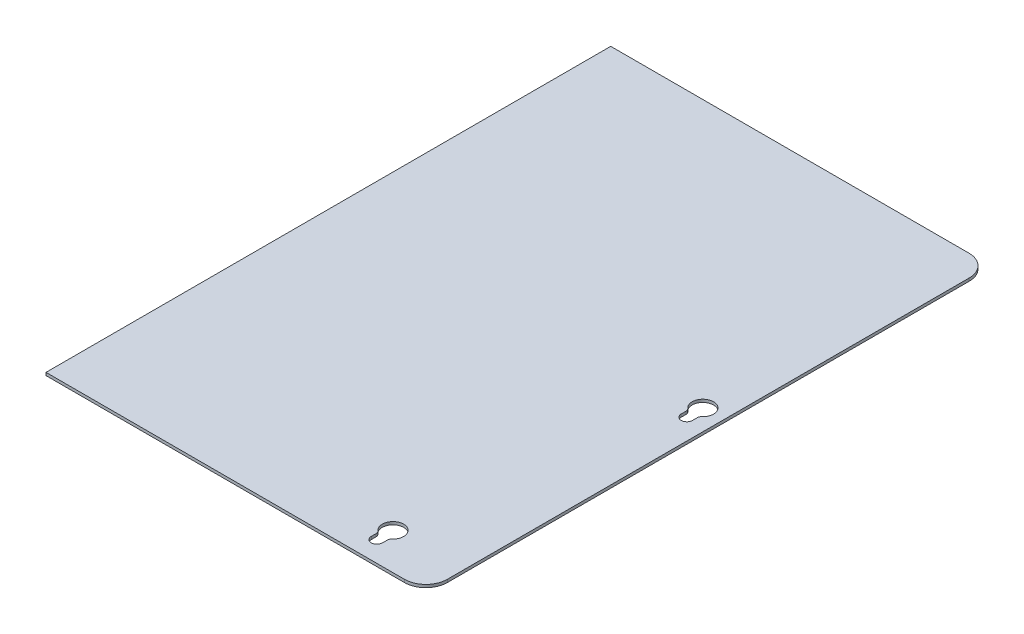
from build123d import *

# Parameters (mm, degrees)
BASE_FLANGE2_DEPTH         = 1.33
EDGE_FLANGE3_DEPTH         = 263.681161317
CAPTIVE_M5_BOLT_SLOT_REACH = 370.8
HOLE_FILLETS_R             = 2
HEM2_START                 = -67.833575783
HEM2_DEPTH                 = 263.681161317
HEM2_2_DEPTH               = 263.681161317
FLAT_PATTERN2_START        = -67.833575783
FLAT_PATTERN2_DEPTH        = 263.681161317
FLAT_PATTERN2_2_DEPTH      = 263.681161317


# Read off the part's stored shape, not the designer's step: Hem2, Flat-Pattern2
# Sheet-metal steps are written as plain solids
with BuildPart() as part:
    # Sketch5 → Base-Flange2 (new body)
    with BuildSketch(Plane(origin=(0, -63.655404639, 0), x_dir=(-1, 0, 0), z_dir=(0, 1, 0))):
        with BuildLine():
            Line((-297.802816543, 195.847585534), (-194.039416543, 195.847585534))
            Line((-194.039416543, 195.847585534), (-194.039416543, -67.833575783))
            Line((-194.039416543, -67.833575783), (-297.802816543, -67.833575783))
            ThreePointArc((-297.802816543, -67.833575783), (-304.873884355, -64.904643594), (-307.802816543, -57.833575783))
            Line((-307.802816543, -57.833575783), (-307.802816543, 185.847585534))
            ThreePointArc((-307.802816543, 185.847585534), (-304.873884355, 192.918653346), (-297.802816543, 195.847585534))
        make_face()
    extrude(amount=BASE_FLANGE2_DEPTH)

    # Edge-Flange3 section (across the edge) → Edge-Flange3 (add)
    with BuildSketch(Plane(origin=(193.302816543, -63.655404639, 195.847585534), x_dir=(1, 0, 0), z_dir=(0, 0, -1))):
        with BuildLine():
            Line((-1.33, 0.7366), (-1.33, 52.66))
            Line((-1.33, 52.66), (0, 52.66))
            Line((0, 52.66), (0, 0.7366))
            ThreePointArc((0, 0.7366), (0.215745145, 0.215745145), (0.7366, 0))
            Line((0.7366, 0), (0.7366, -1.33))
            ThreePointArc((0.7366, -1.33), (-0.724706874, -0.724706874), (-1.33, 0.7366))
        make_face()
    extrude(amount=EDGE_FLANGE3_DEPTH)

    # Sketch17 → Captive M5 Bolt Slot (cut, up to next)
    with BuildSketch(Plane(origin=(0, -62.325404639, 0), x_dir=(1, 0, 0), z_dir=(0, 1, 0)), mode=Mode.PRIVATE) as captive_m5_bolt_slot_sk1:
        with BuildLine():
            ThreePointArc((280.302816543, -178.715885534), (272.866117957, -174.349823235), (272.677816543, -182.971396667))
            Line((272.677816543, -182.971396667), (272.677816543, -178.715885534))
            ThreePointArc((272.677816543, -178.715885534), (275.302816543, -176.090885534), (277.927816543, -178.715885534))
            Line((277.927816543, -178.715885534), (277.927816543, -182.971396667))
            ThreePointArc((277.927816543, -182.971396667), (279.668878843, -181.15258412), (280.302816543, -178.715885534))
        make_face()
    captive_m5_bolt_slot_tool1 = extrude(captive_m5_bolt_slot_sk1.sketch, amount=-CAPTIVE_M5_BOLT_SLOT_REACH, mode=Mode.PRIVATE) & part.part
    # Sketch17 → Captive M5 Bolt Slot (cut, up to next)
    with BuildSketch(Plane(origin=(0, -62.325404639, 0), x_dir=(1, 0, 0), z_dir=(0, 1, 0)), mode=Mode.PRIVATE) as captive_m5_bolt_slot_sk2:
        with BuildLine():
            Line((272.677816543, -178.715885534), (272.677816543, -182.971396667))
            ThreePointArc((272.677816543, -182.971396667), (275.302816543, -183.715885534), (277.927816543, -182.971396667))
            Line((277.927816543, -182.971396667), (277.927816543, -178.715885534))
            ThreePointArc((277.927816543, -178.715885534), (275.302816543, -176.090885534), (272.677816543, -178.715885534))
        make_face()
    captive_m5_bolt_slot_tool2 = extrude(captive_m5_bolt_slot_sk2.sketch, amount=-CAPTIVE_M5_BOLT_SLOT_REACH, mode=Mode.PRIVATE) & part.part
    # Sketch17 → Captive M5 Bolt Slot (cut, up to next)
    with BuildSketch(Plane(origin=(0, -62.325404639, 0), x_dir=(1, 0, 0), z_dir=(0, 1, 0)), mode=Mode.PRIVATE) as captive_m5_bolt_slot_sk3:
        with BuildLine():
            ThreePointArc((280.302816543, -178.715885534), (272.866117957, -174.349823235), (272.677816543, -182.971396667))
            Line((272.677816543, -182.971396667), (272.677816543, -178.715885534))
            ThreePointArc((272.677816543, -178.715885534), (275.302816543, -176.090885534), (277.927816543, -178.715885534))
            Line((277.927816543, -178.715885534), (277.927816543, -182.971396667))
            ThreePointArc((277.927816543, -182.971396667), (279.668878843, -181.15258412), (280.302816543, -178.715885534))
        make_face()
    captive_m5_bolt_slot_tool3 = extrude(captive_m5_bolt_slot_sk3.sketch, amount=-CAPTIVE_M5_BOLT_SLOT_REACH, mode=Mode.PRIVATE) & part.part
    # Sketch17 → Captive M5 Bolt Slot (cut, up to next)
    with BuildSketch(Plane(origin=(0, -62.325404639, 0), x_dir=(1, 0, 0), z_dir=(0, 1, 0)), mode=Mode.PRIVATE) as captive_m5_bolt_slot_sk4:
        with BuildLine():
            Line((272.677816543, -178.715885534), (272.677816543, -182.971396667))
            ThreePointArc((272.677816543, -182.971396667), (275.302816543, -183.715885534), (277.927816543, -182.971396667))
            Line((277.927816543, -182.971396667), (277.927816543, -178.715885534))
            ThreePointArc((277.927816543, -178.715885534), (275.302816543, -176.090885534), (272.677816543, -178.715885534))
        make_face()
    captive_m5_bolt_slot_tool4 = extrude(captive_m5_bolt_slot_sk4.sketch, amount=-CAPTIVE_M5_BOLT_SLOT_REACH, mode=Mode.PRIVATE) & part.part
    # Sketch17 → Captive M5 Bolt Slot (cut, up to next)
    with BuildSketch(Plane(origin=(0, -62.325404639, 0), x_dir=(1, 0, 0), z_dir=(0, 1, 0)), mode=Mode.PRIVATE) as captive_m5_bolt_slot_sk5:
        with BuildLine():
            Line((272.677816543, -182.971396667), (272.677816543, -186.215885534))
            ThreePointArc((272.677816543, -186.215885534), (275.302816543, -188.840885534), (277.927816543, -186.215885534))
            Line((277.927816543, -186.215885534), (277.927816543, -182.971396667))
            ThreePointArc((277.927816543, -182.971396667), (275.302816543, -183.715885534), (272.677816543, -182.971396667))
        make_face()
    captive_m5_bolt_slot_tool5 = extrude(captive_m5_bolt_slot_sk5.sketch, amount=-CAPTIVE_M5_BOLT_SLOT_REACH, mode=Mode.PRIVATE) & part.part
    # Sketch17 → Captive M5 Bolt Slot (cut, up to next)
    with BuildSketch(Plane(origin=(0, -62.325404639, 0), x_dir=(1, 0, 0), z_dir=(0, 1, 0)), mode=Mode.PRIVATE) as captive_m5_bolt_slot_sk6:
        with BuildLine():
            ThreePointArc((303.171116543, -56.875304876), (295.734417957, -52.509242577), (295.546116543, -61.130816008))
            Line((295.546116543, -61.130816008), (295.546116543, -56.875304876))
            ThreePointArc((295.546116543, -56.875304876), (298.171116543, -54.250304876), (300.796116543, -56.875304876))
            Line((300.796116543, -56.875304876), (300.796116543, -61.130816008))
            ThreePointArc((300.796116543, -61.130816008), (302.537178843, -59.312003462), (303.171116543, -56.875304876))
        make_face()
    captive_m5_bolt_slot_tool6 = extrude(captive_m5_bolt_slot_sk6.sketch, amount=-CAPTIVE_M5_BOLT_SLOT_REACH, mode=Mode.PRIVATE) & part.part
    # Sketch17 → Captive M5 Bolt Slot (cut, up to next)
    with BuildSketch(Plane(origin=(0, -62.325404639, 0), x_dir=(1, 0, 0), z_dir=(0, 1, 0)), mode=Mode.PRIVATE) as captive_m5_bolt_slot_sk7:
        with BuildLine():
            Line((295.546116543, -56.875304876), (295.546116543, -61.130816008))
            ThreePointArc((295.546116543, -61.130816008), (298.171116543, -61.875304876), (300.796116543, -61.130816008))
            Line((300.796116543, -61.130816008), (300.796116543, -56.875304876))
            ThreePointArc((300.796116543, -56.875304876), (298.171116543, -54.250304876), (295.546116543, -56.875304876))
        make_face()
    captive_m5_bolt_slot_tool7 = extrude(captive_m5_bolt_slot_sk7.sketch, amount=-CAPTIVE_M5_BOLT_SLOT_REACH, mode=Mode.PRIVATE) & part.part
    # Sketch17 → Captive M5 Bolt Slot (cut, up to next)
    with BuildSketch(Plane(origin=(0, -62.325404639, 0), x_dir=(1, 0, 0), z_dir=(0, 1, 0)), mode=Mode.PRIVATE) as captive_m5_bolt_slot_sk8:
        with BuildLine():
            ThreePointArc((303.171116543, -56.875304876), (295.734417957, -52.509242577), (295.546116543, -61.130816008))
            Line((295.546116543, -61.130816008), (295.546116543, -56.875304876))
            ThreePointArc((295.546116543, -56.875304876), (298.171116543, -54.250304876), (300.796116543, -56.875304876))
            Line((300.796116543, -56.875304876), (300.796116543, -61.130816008))
            ThreePointArc((300.796116543, -61.130816008), (302.537178843, -59.312003462), (303.171116543, -56.875304876))
        make_face()
    captive_m5_bolt_slot_tool8 = extrude(captive_m5_bolt_slot_sk8.sketch, amount=-CAPTIVE_M5_BOLT_SLOT_REACH, mode=Mode.PRIVATE) & part.part
    # Sketch17 → Captive M5 Bolt Slot (cut, up to next)
    with BuildSketch(Plane(origin=(0, -62.325404639, 0), x_dir=(1, 0, 0), z_dir=(0, 1, 0)), mode=Mode.PRIVATE) as captive_m5_bolt_slot_sk9:
        with BuildLine():
            Line((295.546116543, -56.875304876), (295.546116543, -61.130816008))
            ThreePointArc((295.546116543, -61.130816008), (298.171116543, -61.875304876), (300.796116543, -61.130816008))
            Line((300.796116543, -61.130816008), (300.796116543, -56.875304876))
            ThreePointArc((300.796116543, -56.875304876), (298.171116543, -54.250304876), (295.546116543, -56.875304876))
        make_face()
    captive_m5_bolt_slot_tool9 = extrude(captive_m5_bolt_slot_sk9.sketch, amount=-CAPTIVE_M5_BOLT_SLOT_REACH, mode=Mode.PRIVATE) & part.part
    # Sketch17 → Captive M5 Bolt Slot (cut, up to next)
    with BuildSketch(Plane(origin=(0, -62.325404639, 0), x_dir=(1, 0, 0), z_dir=(0, 1, 0)), mode=Mode.PRIVATE) as captive_m5_bolt_slot_sk10:
        with BuildLine():
            Line((295.546116543, -61.130816008), (295.546116543, -64.375304876))
            ThreePointArc((295.546116543, -64.375304876), (298.171116543, -67.000304876), (300.796116543, -64.375304876))
            Line((300.796116543, -64.375304876), (300.796116543, -61.130816008))
            ThreePointArc((300.796116543, -61.130816008), (298.171116543, -61.875304876), (295.546116543, -61.130816008))
        make_face()
    captive_m5_bolt_slot_tool10 = extrude(captive_m5_bolt_slot_sk10.sketch, amount=-CAPTIVE_M5_BOLT_SLOT_REACH, mode=Mode.PRIVATE) & part.part
    add(captive_m5_bolt_slot_tool1.solids().sort_by_distance((272.932522, -62.325405, 174.468806))[0], mode=Mode.SUBTRACT)
    add(captive_m5_bolt_slot_tool2.solids().sort_by_distance((275.302817, -62.325405, 180.043279))[0], mode=Mode.SUBTRACT)
    add(captive_m5_bolt_slot_tool3.solids().sort_by_distance((272.932522, -62.325405, 174.468806))[0], mode=Mode.SUBTRACT)
    add(captive_m5_bolt_slot_tool4.solids().sort_by_distance((275.302817, -62.325405, 180.043279))[0], mode=Mode.SUBTRACT)
    add(captive_m5_bolt_slot_tool5.solids().sort_by_distance((275.302817, -62.325405, 185.907324))[0], mode=Mode.SUBTRACT)
    add(captive_m5_bolt_slot_tool6.solids().sort_by_distance((302.418196, -62.325405, 59.245599))[0], mode=Mode.SUBTRACT)
    add(captive_m5_bolt_slot_tool7.solids().sort_by_distance((298.171117, -62.325405, 58.202699))[0], mode=Mode.SUBTRACT)
    add(captive_m5_bolt_slot_tool8.solids().sort_by_distance((302.418196, -62.325405, 59.245599))[0], mode=Mode.SUBTRACT)
    add(captive_m5_bolt_slot_tool9.solids().sort_by_distance((298.171117, -62.325405, 58.202699))[0], mode=Mode.SUBTRACT)
    add(captive_m5_bolt_slot_tool10.solids().sort_by_distance((298.171117, -62.325405, 64.066743))[0], mode=Mode.SUBTRACT)

    # Hole Fillets
    hole_fillets_edges = [part.edges().sort_by_distance(p)[0] for p in [
        (272.677816543, -62.990404639, 182.971396667),
        (277.927816543, -62.990404639, 182.971396667),
        (300.796116543, -62.990404639, 61.130816008),
        (295.546116543, -62.990404639, 61.130816008),
    ]]
    fillet(hole_fillets_edges, radius=HOLE_FILLETS_R)

    # Hem2 outline → Hem2 (cut)
    with BuildSketch(Plane.XY.offset(HEM2_START)):
        with BuildLine():
            Line((193.302816543, -116.315404639), (193.302816543, -116.314498544))
            ThreePointArc((193.302816543, -116.314498544), (192.359488803, -115.893371235), (191.972816543, -114.935404639))
            Line((191.972816543, -114.935404639), (191.972816543, -116.315404639))
            Line((191.972816543, -116.315404639), (193.302816543, -116.315404639))
        make_face()
    extrude(amount=HEM2_DEPTH, mode=Mode.SUBTRACT)

    # Hem2 2 outline → Hem2 2 (add)
    with BuildSketch(Plane.XY.offset(HEM2_START)):
        with BuildLine():
            Line((194.732816543, -106.315404639), (193.402816543, -106.315404639))
            Line((193.402816543, -106.315404639), (193.402816543, -114.935404639))
            ThreePointArc((193.402816543, -114.935404639), (193.352816543, -114.985404639), (193.302816543, -114.935404639))
            Line((193.302816543, -114.935404639), (193.302816543, -116.314498544))
            ThreePointArc((193.302816543, -116.314498544), (194.310783139, -115.928732379), (194.732816543, -114.935404639))
            Line((194.732816543, -114.935404639), (194.732816543, -106.315404639))
        make_face()
    extrude(amount=HEM2_2_DEPTH)

    # Flat-Pattern2 outline → Flat-Pattern2 (cut)
    with BuildSketch(Plane.XY.offset(FLAT_PATTERN2_START)):
        with BuildLine():
            Line((194.039416543, -63.655404639), (192.108547309, -63.655404639))
            ThreePointArc((192.108547309, -63.655404639), (192.007032485, -64.017504171), (191.972816543, -64.392004639))
            Line((191.972816543, -64.392004639), (191.972816543, -114.935404639))
            ThreePointArc((191.972816543, -114.935404639), (193.352816543, -116.315404639), (194.732816543, -114.935404639))
            Line((194.732816543, -114.935404639), (194.732816543, -106.315404639))
            Line((194.732816543, -106.315404639), (193.402816543, -106.315404639))
            Line((193.402816543, -106.315404639), (193.402816543, -114.935404639))
            ThreePointArc((193.402816543, -114.935404639), (193.352816543, -114.985404639), (193.302816543, -114.935404639))
            Line((193.302816543, -114.935404639), (193.302816543, -64.392004639))
            ThreePointArc((193.302816543, -64.392004639), (193.518561688, -63.871149784), (194.039416543, -63.655404639))
        make_face()
    extrude(amount=FLAT_PATTERN2_DEPTH, mode=Mode.SUBTRACT)

    # Flat-Pattern2 2 outline → Flat-Pattern2 2 (add)
    with BuildSketch(Plane.XY.offset(FLAT_PATTERN2_START)):
        with BuildLine():
            ThreePointArc((192.108547309, -63.655404639), (192.867115814, -62.690080269), (194.039416543, -62.325404639))
            Line((194.039416543, -62.325404639), (130.428149664, -62.325404639))
            Line((130.428149664, -62.325404639), (130.428149664, -63.655404639))
            Line((130.428149664, -63.655404639), (192.108547309, -63.655404639))
        make_face()
    extrude(amount=FLAT_PATTERN2_2_DEPTH)


solid = part.part
